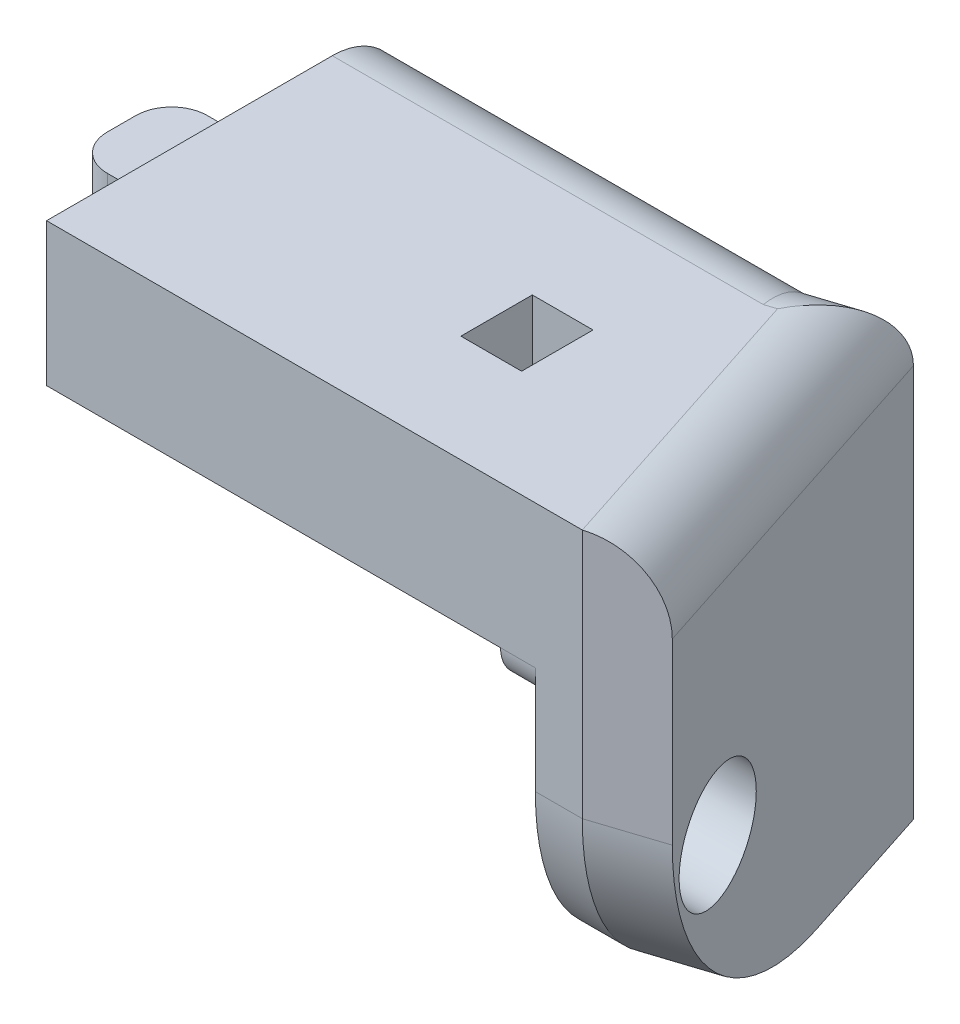
from build123d import *

# Parameters (mm, degrees)
BOSS_EXTRUDE1_DEPTH     = 33.02
CUT_EXTRUDE1_DEPTH      = 20.32
FILLET1_R               = 15.24
SKETCH4_W               = 4.318
SKETCH4_H               = 5.08
CUT_EXTRUDE3_DEPTH      = 20.32
FILLET2_R               = 2.54
BOSS_EXTRUDE2_DEPTH     = 5.08
BOSS_EXTRUDE3_DEPTH     = 5.08
CUT_EXTRUDE2_DEPTH      = 88.392
CUT_EXTRUDE2_DEPTH_BACK = 20.32
SKETCH3_R               = 4.064
FILLET3_R               = 5.08
SKETCH7_W               = 44.236060242
SKETCH7_H               = 34.660368577
CUT_EXTRUDE4_DEPTH      = 37.084
SKETCH8_W               = 7.112
SKETCH8_H               = 3.81
BOSS_EXTRUDE4_DEPTH     = 4.826
FILLET4_R               = 2.54
SKETCH9_W               = 32.557227401
SKETCH9_H               = 7.62
CUT_EXTRUDE5_DEPTH      = 2.54


with BuildPart() as part:
    # Sketch1 → Boss-Extrude1 (new body)
    with BuildSketch(Plane(origin=(0, 0, 0), x_dir=(1, 0, 0), z_dir=(0, 1, 0))):
        Polygon((0, 0), (-8.252960284, -25.4), (67.947039716, -25.4), (59.694079431, 0), align=None)
    extrude(amount=BOSS_EXTRUDE1_DEPTH)

    # Sketch2 → Cut-Extrude1 (cut)
    with BuildSketch(Plane.XZ):
        Polygon((-3.882947687, 22.225), (-6.015103815, 28.787101815), (66.521112465, 31.285963003), (63.577027118, 22.225), (57.387306905, 3.175), (55.156358593, -3.691152891), (4.897822181, -4.799430866), (2.306772526, 3.175), align=None)
    extrude(amount=-CUT_EXTRUDE1_DEPTH, mode=Mode.SUBTRACT)

    # Fillet1
    # the kernel refuses this fillet: 15.24 mm, written as the material it takes off along each edge
    with BuildSketch(Plane(origin=(26.508647154, 0, 25.4), x_dir=(0, 1, 0), z_dir=(1, 0, 0)), Plane(origin=(-46.352960284, 0, 25.4), x_dir=(0, 1, 0), z_dir=(1, 0, 0))) as fillet1_piece_1:
        with BuildLine():
            CenterArc((FILLET1_R, -FILLET1_R), FILLET1_R, 90, 90)
            Line((0, -FILLET1_R), (0, 0))
            Line((0, 0), (FILLET1_R, 0))
        make_face()
    extrude(amount=79.538392562, mode=Mode.SUBTRACT)

    # Sketch4 → Cut-Extrude3 (cut)
    with BuildSketch(Plane(origin=(0, 33.02, 0), x_dir=(1, 0, 0), z_dir=(0, 1, 0))):
        with Locations((53.850039716, -15.24)):
            Rectangle(SKETCH4_W, SKETCH4_H)
        with Locations((5.844039716, -15.24)):
            Rectangle(SKETCH4_W, SKETCH4_H)
    extrude(amount=-CUT_EXTRUDE3_DEPTH, mode=Mode.SUBTRACT)

    # Fillet2
    fillet2_edges = [part.edges().sort_by_distance(p)[0] for p in [
        (29.847039716, 20.32, 25.4),
    ]]
    fillet(fillet2_edges, radius=FILLET2_R)

    # Sketch5 → Boss-Extrude2 (add)
    with BuildSketch(Plane(origin=(0, 0, 0), x_dir=(-0.3090169943749446, 0, 0.9510565162951545), z_dir=(-0.9510565162951545, 0, -0.3090169943749446))):
        with BuildLine():
            Line((0, 0), (10.682856198, 0))
            add(Edge.make_bspline(
                [(10.682856198, 0), (26.707140496, 0), (26.707140496, 15.24)],
                knots=[1.570796327, 1.570796327, 1.570796327, 3.141592654, 3.141592654, 3.141592654], degree=2, weights=[1, 0.707106781, 1]))
            Line((26.707140496, 15.24), (26.707140496, 33.02))
            Line((26.707140496, 33.02), (0, 33.02))
            Line((0, 33.02), (0, 0))
        make_face()
    extrude(amount=BOSS_EXTRUDE2_DEPTH)

    # Sketch6 → Boss-Extrude3 (add)
    with BuildSketch(Plane(origin=(53.993802077, 0, -17.543649769), x_dir=(-0.30901699437494445, 0, -0.9510565162951545), z_dir=(0.9510565162951545, 0, -0.30901699437494445))):
        with BuildLine():
            Line((-45.153625504, 33.02), (-45.153625504, 15.24))
            add(Edge.make_bspline(
                [(-45.153625504, 15.24), (-45.153625504, 0), (-29.129341206, 0)],
                knots=[0, 0, 0, 1.570796327, 1.570796327, 1.570796327], degree=2, weights=[1, 0.707106781, 1]))
            Line((-29.129341206, 0), (-18.446485008, 0))
            Line((-18.446485008, 0), (-18.446485008, 33.02))
            Line((-18.446485008, 33.02), (-45.153625504, 33.02))
        make_face()
    extrude(amount=BOSS_EXTRUDE3_DEPTH)

    # Sketch3 → Cut-Extrude2 (cut, two sides: drawn at the far end of the back side and taken through both)
    with BuildSketch(Plane(origin=(0, 0, 0), x_dir=(0, 0, -1), z_dir=(1, 0, 0)).offset(-CUT_EXTRUDE2_DEPTH_BACK)):
        with Locations((-19.05, 12.7)):
            Circle(SKETCH3_R)
    extrude(amount=CUT_EXTRUDE2_DEPTH + CUT_EXTRUDE2_DEPTH_BACK, mode=Mode.SUBTRACT)

    # Fillet3
    fillet3_edges = [part.edges().sort_by_distance(p)[0] for p in [
        (-2.415683551, 33.02, -0.784903166),
        (62.109762983, 33.02, -0.784903166),
        (29.847039716, 33.02, 0),
        (-8.957847245, 33.02, 11.130193669),
        (68.651926676, 33.02, 11.130193669),
    ]]
    fillet(fillet3_edges, radius=FILLET3_R)

    # Sketch7 → Cut-Extrude4 (cut)
    with BuildSketch(Plane(origin=(0, 33.02, 0), x_dir=(1, 0, 0), z_dir=(0, 1, 0))):
        with Locations((7.729009595, -8.069815712)):
            Rectangle(SKETCH7_W, SKETCH7_H)
    extrude(amount=-CUT_EXTRUDE4_DEPTH, mode=Mode.SUBTRACT)

    # Sketch8 → Boss-Extrude4 (add)
    with BuildSketch(Plane.ZY.offset(-29.847039716)):
        with Locations((15.24, 29.591)):
            Rectangle(SKETCH8_W, SKETCH8_H)
    extrude(amount=BOSS_EXTRUDE4_DEPTH)

    # Fillet4
    fillet4_edges = [part.edges().sort_by_distance(p)[0] for p in [
        (25.021039716, 29.591, 18.796),
        (25.021039716, 29.591, 11.684),
    ]]
    fillet(fillet4_edges, radius=FILLET4_R)

    # Sketch9 → Cut-Extrude5 (cut)
    with BuildSketch(Plane.XZ.offset(-20.32)):
        with Locations((45.854145368, 21.59)):
            Rectangle(SKETCH9_W, SKETCH9_H)
    extrude(amount=-CUT_EXTRUDE5_DEPTH, mode=Mode.SUBTRACT)


solid = part.part
